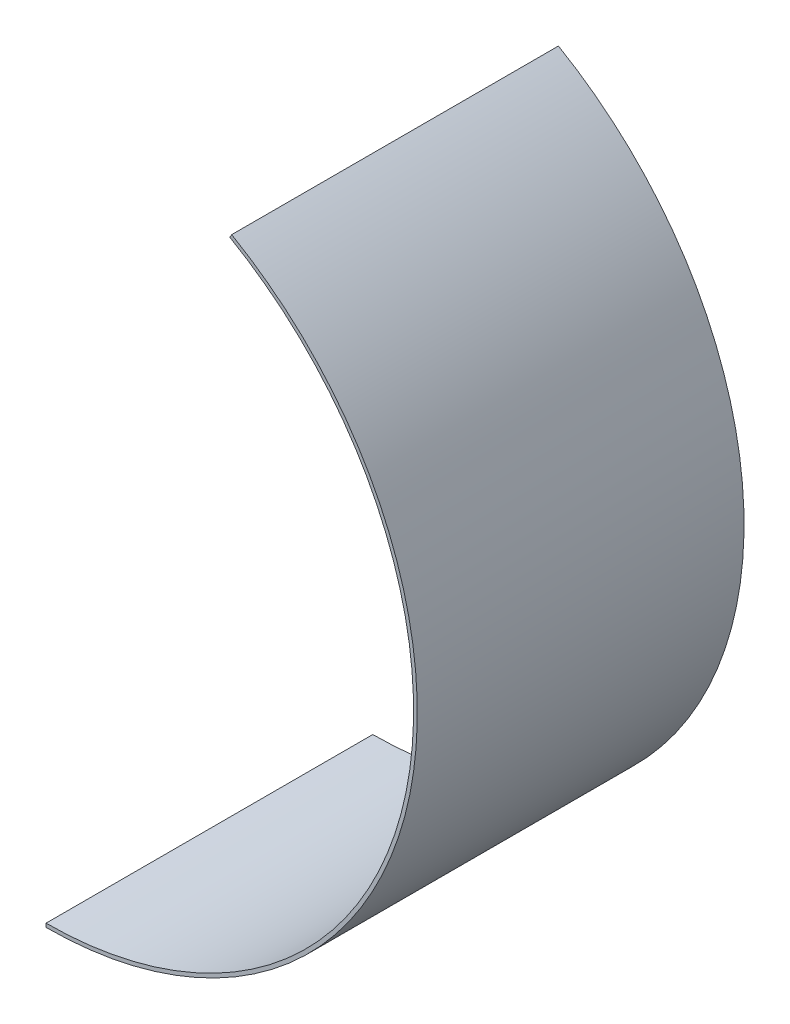
from build123d import *

# Parameters (mm, degrees)
BASE_FLANGE1_DEPTH = 139.7


# Sheet-metal steps are written as plain solids
with BuildPart() as part:
    # Sketch1 → Base-Flange1 (new body)
    with BuildSketch(Plane.XY):
        with BuildLine():
            ThreePointArc((78.58125, 136.106717522), (136.106717522, 78.58125), (157.1625, 0))
            ThreePointArc((157.1625, 0), (111.130669498, -111.130669498), (0, -157.1625))
            Line((0, -157.1625), (0, -158.75))
            ThreePointArc((0, -158.75), (112.253201513, -112.253201513), (158.75, 0))
            ThreePointArc((158.75, 0), (137.481532851, 79.375), (79.375, 137.481532851))
            Line((79.375, 137.481532851), (78.58125, 136.106717522))
        make_face()
    extrude(amount=BASE_FLANGE1_DEPTH)


solid = part.part
